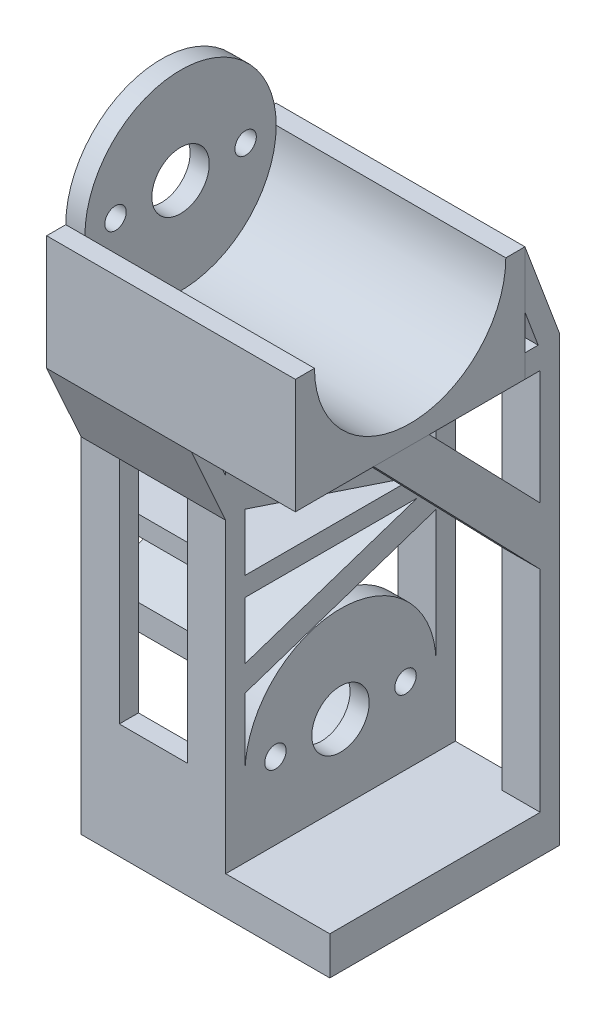
from build123d import *

# Parameters (mm, degrees)
SKETCH1_R                        = 12.5
SKETCH1_R_2                      = 3.75
SKETCH1_R_3                      = 1.4
BOSS_EXTRUDE1_DEPTH              = 2.5
BOSS_EXTRUDE12_START             = 2.5
SKETCH14_R                       = 12.5
SKETCH14_R_2                     = 3.75
SKETCH14_R_3                     = 1.4
BOSS_EXTRUDE12_DEPTH             = 2.5
BOSS_EXTRUDE13_START             = -2.5
BOSS_EXTRUDE13_DEPTH             = 18.9
BOSS_EXTRUDE14_DEPTH             = 30
BOSS_EXTRUDE14_DIRECTION_2_REACH = 73.514
SKETCH17_W                       = 5
SKETCH17_H                       = 2.5
BOSS_EXTRUDE15_DEPTH             = 40
SKETCH19_W                       = 5
SKETCH19_H                       = 2.5
BOSS_EXTRUDE16_DEPTH             = 40
BOSS_EXTRUDE17_START             = -18.9
BOSS_EXTRUDE17_DEPTH             = 32.5
BOSS_EXTRUDE19_START             = -18.9
BOSS_EXTRUDE19_DEPTH             = 18.9
BOSS_EXTRUDE20_START             = -18.9
BOSS_EXTRUDE20_DEPTH             = 18.9
SKETCH24_W                       = 30
SKETCH24_H                       = 5
BOSS_EXTRUDE21_DEPTH             = 13.6
SKETCH25_W                       = 2.5
SKETCH25_H                       = 50
BOSS_EXTRUDE22_DEPTH             = 5
BOSS_EXTRUDE23_DEPTH             = 5


# Read off the part's stored shape, not the designer's step: Boss-Extrude20
with BuildPart() as part:
    # Sketch1 → Boss-Extrude1 (new body)
    with BuildSketch(Plane(origin=(0, 0, 0), x_dir=(0, 0, -1), z_dir=(1, 0, 0))):
        Circle(SKETCH1_R)
        Circle(SKETCH1_R_2, mode=Mode.SUBTRACT)
        with Locations((8.5, 0)):
            Circle(SKETCH1_R_3, mode=Mode.SUBTRACT)
        with Locations((-8.5, 0)):
            Circle(SKETCH1_R_3, mode=Mode.SUBTRACT)
    extrude(amount=BOSS_EXTRUDE1_DEPTH)

    # Sketch15 → Boss-Extrude13 (add)
    with BuildSketch(Plane.ZY.offset(BOSS_EXTRUDE13_START)):
        with BuildLine():
            Line((-15, -15), (15, -15))
            Line((15, -15), (15, 0))
            Line((15, 0), (12.5, 0))
            ThreePointArc((12.5, 0), (0, -12.5), (-12.5, 0))
            Line((-12.5, 0), (-15, 0))
            Line((-15, 0), (-15, -15))
        make_face()
    extrude(amount=BOSS_EXTRUDE13_DEPTH)

    # Sketch17 → Boss-Extrude15 (add)
    with BuildSketch(Plane(origin=(0, 0, 0), x_dir=(1, 0, 0), z_dir=(0, 1, 0))):
        with Locations((-13.9, 13.75)):
            Rectangle(SKETCH17_W, SKETCH17_H)
        with Locations((0, 13.75)):
            Rectangle(SKETCH17_W, SKETCH17_H)
    extrude(amount=BOSS_EXTRUDE15_DEPTH)

    # Sketch19 → Boss-Extrude16 (add)
    with BuildSketch(Plane(origin=(0, 0, 0), x_dir=(1, 0, 0), z_dir=(0, 1, 0))):
        with Locations((-13.9, -13.75)):
            Rectangle(SKETCH19_W, SKETCH19_H)
        with Locations((0, -13.75)):
            Rectangle(SKETCH19_W, SKETCH19_H)
    extrude(amount=BOSS_EXTRUDE16_DEPTH)

    # Sketch20 → Boss-Extrude17 (add)
    with BuildSketch(Plane(origin=(2.5, 0, 0), x_dir=(0, 0, -1), z_dir=(1, 0, 0)).offset(BOSS_EXTRUDE17_START)):
        Polygon((15, 40), (10.5, 40), (10.5, 43), (12.23141351, 43), (10.5, 47.617102692), (10.5, 55), (15, 43), align=None)
    extrude(amount=BOSS_EXTRUDE17_DEPTH)

    # Sketch22 → Boss-Extrude19 (add)
    with BuildSketch(Plane(origin=(2.5, 0, 0), x_dir=(0, 0, -1), z_dir=(1, 0, 0)).offset(BOSS_EXTRUDE19_START)):
        Polygon((-12.5, 20), (10, 20), (-12.5, 12.5), (-12.5, 9.166666667), (12.5, 17.5), (12.5, 20), (12.5, 22.5), (12.5, 25), (-10, 32.5), (12.5, 32.5), (12.5, 35), (-12.5, 35), (-12.5, 32.5), (-12.5, 30), (10, 22.5), (-12.5, 22.5), align=None)
    extrude(amount=BOSS_EXTRUDE19_DEPTH)

    # Boss-Extrude20 outline → Boss-Extrude20 (add)
    with BuildSketch(Plane.ZY.offset(16.4).offset(BOSS_EXTRUDE20_START)):
        Polygon((15, 30), (19.5, 40), (17.25, 40), (15, 35), align=None)
    extrude(amount=BOSS_EXTRUDE20_DEPTH)

    # Sketch24 → Boss-Extrude21 (add)
    with BuildSketch(Plane(origin=(2.5, 0, 0), x_dir=(0, 0, -1), z_dir=(1, 0, 0))):
        with Locations((0, -12.5)):
            Rectangle(SKETCH24_W, SKETCH24_H)
    extrude(amount=BOSS_EXTRUDE21_DEPTH)

    # Sketch25 → Boss-Extrude22 (add)
    with BuildSketch(Plane(origin=(16.1, 0, 0), x_dir=(0, 0, -1), z_dir=(1, 0, 0))):
        with Locations((13.75, 15)):
            Rectangle(SKETCH25_W, SKETCH25_H)
    extrude(amount=-BOSS_EXTRUDE22_DEPTH)

    # Sketch26 → Boss-Extrude23 (add)
    with BuildSketch(Plane(origin=(16.1, 0, 0), x_dir=(0, 0, -1), z_dir=(1, 0, 0))):
        Polygon((-9.259125201, 40), (12.5, 17.5), (12.5, 25), (-2.006083467, 40), align=None)
    extrude(amount=-BOSS_EXTRUDE23_DEPTH)


with BuildPart() as body_2:
    # Sketch14 → Boss-Extrude12 (new body)
    with BuildSketch(Plane.ZY.offset(11.4).offset(BOSS_EXTRUDE12_START)):
        with Locations((4.5, 55)):
            Circle(SKETCH14_R)
        with Locations((4.5, 55)):
            Circle(SKETCH14_R_2, mode=Mode.SUBTRACT)
        with Locations((-4, 55)):
            Circle(SKETCH14_R_3, mode=Mode.SUBTRACT)
        with Locations((13, 55)):
            Circle(SKETCH14_R_3, mode=Mode.SUBTRACT)
    extrude(amount=BOSS_EXTRUDE12_DEPTH)

    # Sketch16 → Boss-Extrude14 (add)
    with BuildSketch(Plane(origin=(-13.9, 0, 0), x_dir=(0, 0, -1), z_dir=(1, 0, 0))):
        with BuildLine():
            Line((-17, 55), (-19.5, 55))
            Line((-19.5, 55), (-19.5, 40))
            Line((-19.5, 40), (10.5, 40))
            Line((10.5, 40), (10.5, 55))
            Line((10.5, 55), (8, 55))
            ThreePointArc((8, 55), (-4.5, 42.5), (-17, 55))
        make_face()
    extrude(amount=BOSS_EXTRUDE14_DEPTH)

    # Boss-Extrude14 direction 2: up to this face of the body (flat: up to its plane)
    boss_extrude14_direction_2_end = Plane(body_2.part.faces().sort_by_distance((-16.4, 55, -7.646446609))[0])
    # Sketch16 → Boss-Extrude14 direction 2 (add, up to the picked face)
    with BuildSketch(Plane(origin=(-13.9, 0, 0), x_dir=(0, 0, -1), z_dir=(1, 0, 0)), mode=Mode.PRIVATE) as boss_extrude14_direction_2_sk1:
        with BuildLine():
            Line((-17, 55), (-19.5, 55))
            Line((-19.5, 55), (-19.5, 40))
            Line((-19.5, 40), (10.5, 40))
            Line((10.5, 40), (10.5, 55))
            Line((10.5, 55), (8, 55))
            ThreePointArc((8, 55), (-4.5, 42.5), (-17, 55))
        make_face()
    boss_extrude14_direction_2_tool1 = split(extrude(boss_extrude14_direction_2_sk1.sketch, amount=-BOSS_EXTRUDE14_DIRECTION_2_REACH, mode=Mode.PRIVATE), bisect_by=boss_extrude14_direction_2_end, keep=Keep.BOTH, mode=Mode.PRIVATE)
    add(boss_extrude14_direction_2_tool1.solids().sort_by(Axis((-13.9, 42.16459, 4.5), (-1, 0, 0)))[0])


solid = Compound([part.part, body_2.part])
